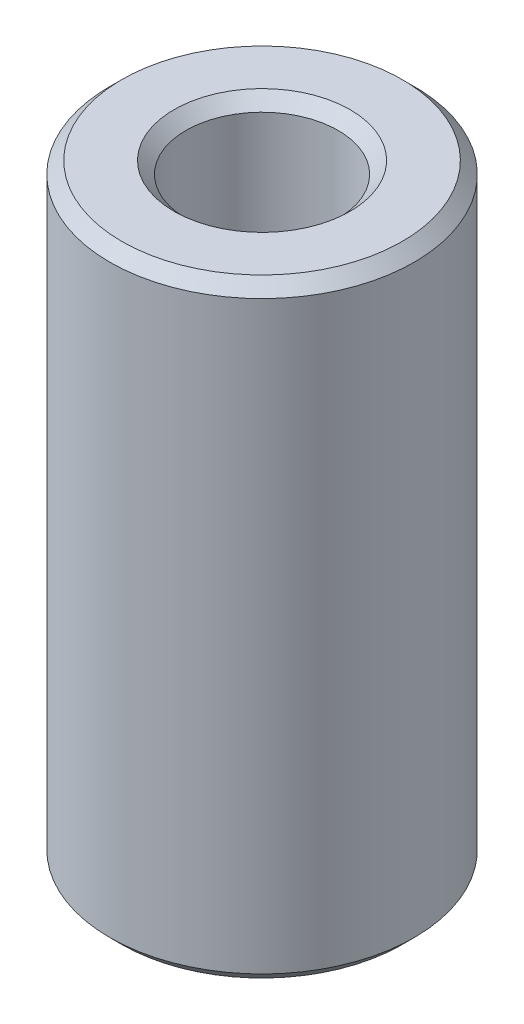
from build123d import *

# Parameters (mm, degrees)
SKETCH1_R           = 6.35
SKETCH1_R_2         = 3.175
BOSS_EXTRUDE1_DEPTH = 25.4
CHAMFER1_SIZE       = 0.5


with BuildPart() as part:
    # Sketch1 → Boss-Extrude1 (new body)
    with BuildSketch(Plane(origin=(0, 0, 0), x_dir=(1, 0, 0), z_dir=(0, 1, 0))):
        Circle(SKETCH1_R)
        Circle(SKETCH1_R_2, mode=Mode.SUBTRACT)
    extrude(amount=BOSS_EXTRUDE1_DEPTH)

    # Chamfer1
    chamfer1_edges = [part.edges().sort_by_distance(p)[0] for p in [
        (-6.35, 0, 0),
        (-3.175, 0, 0),
        (-6.35, 25.4, 0),
        (-3.175, 25.4, 0),
    ]]
    chamfer(chamfer1_edges, length=CHAMFER1_SIZE)


solid = part.part
